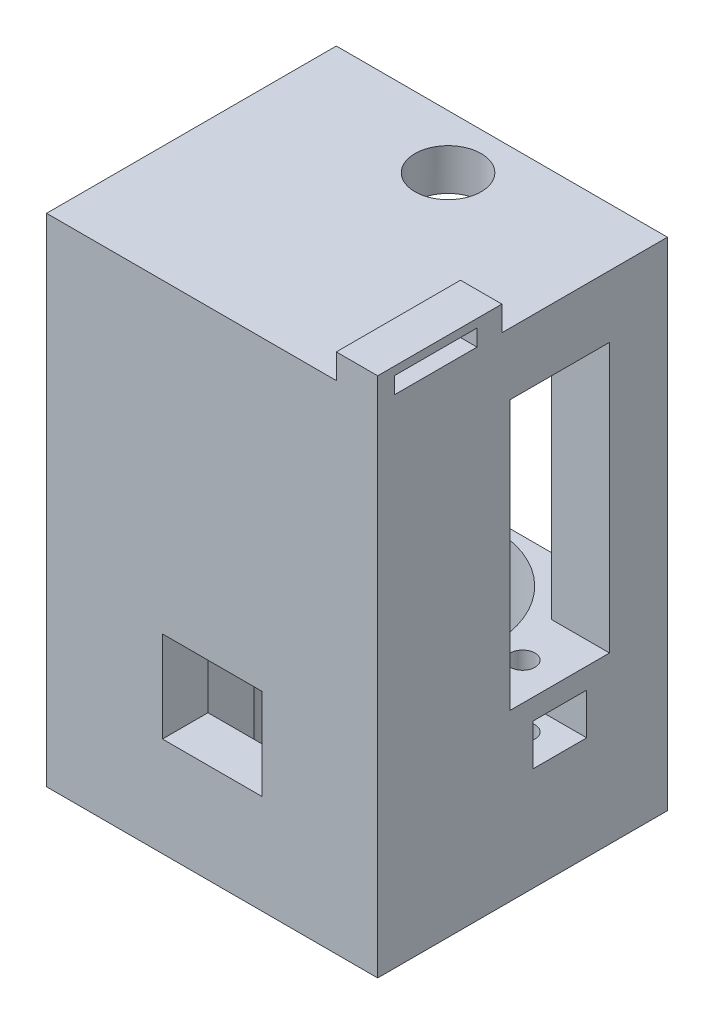
from build123d import *

# Parameters (mm, degrees)
ESBO_O2_W                                     = 40
ESBO_O2_H                                     = 35
BASE_DEPTH                                    = 20
FURO_DO_ENCAIXE_DO_MOTOR_DEPTH                = 57.789083458
ESBO_O5_R                                     = 1.5
FURO_DOS_PARAFUSOS_DO_MOTOR_DEPTH             = 57.789083458
ESBO_O6_W                                     = 6.5
ESBO_O6_H                                     = 5
FURO_DA_ARRUELA_PARA_PARAFUSOS_DO_MOTOR_DEPTH = 57.789083458
ESBO_O7_W                                     = 12
ESBO_O7_H                                     = 21.613382206
CALHA_PARA_OS_CABOS_DO_MOTOR_DEPTH            = 8
ESBO_O10_W                                    = 7
ESBO_O10_H                                    = 7
BASE_EXTENDIDA_DEPTH                          = 35
CHANFRO_DA_BASE_EXTENDIDA_REACH               = 75.068
PONTE_1_REACH                                 = 72.612
ESBO_O12_W                                    = 7
ESBO_O12_H                                    = 2.5
PONTE_2_REACH                                 = 72.612
ESBO_O13_W                                    = 7
ESBO_O13_H                                    = 2.5
ESBO_O14_W                                    = 40
ESBO_O14_H                                    = 35
TELHADO_DEPTH                                 = 5
ESBO_O16_W                                    = 5
ESBO_O16_H                                    = 15
RESSALTO_EXTRUS_O6_DEPTH                      = 3
ESBO_O17_W                                    = 10
ESBO_O17_H                                    = 2
CORTE_EXTRUS_O6_DEPTH                         = 8
ESBO_O18_R                                    = 4
FURO_DO_EIXO_DEPTH                            = 8
ESBO_O20_W                                    = 12
ESBO_O20_H                                    = 6
CORTE_EXTRUS_O8_DEPTH                         = 15


with BuildPart() as part:
    # Esboço2 → Base (new body)
    with BuildSketch(Plane(origin=(0, 0, 0), x_dir=(1, 0, 0), z_dir=(0, 1, 0))):
        with Locations((20, 17.5)):
            Rectangle(ESBO_O2_W, ESBO_O2_H)
    extrude(amount=BASE_DEPTH)

    # Esboço3 → Furo do encaixe do motor (cut, through all)
    with BuildSketch(Plane(origin=(0, 20, 0), x_dir=(1, 0, 0), z_dir=(0, 1, 0))):
        with BuildLine():
            Line((11.25, 13.787966147), (11.25, 5.5))
            Line((11.25, 5.5), (28.75, 5.5))
            Line((28.75, 5.5), (28.75, 13.787966147))
            ThreePointArc((28.75, 13.787966147), (20, 34), (11.25, 13.787966147))
        make_face()
    extrude(amount=-FURO_DO_ENCAIXE_DO_MOTOR_DEPTH, mode=Mode.SUBTRACT)

    # Esboço5 → Furo dos parafusos do motor (cut, through all)
    with BuildSketch(Plane(origin=(0, 20, 0), x_dir=(1, 0, 0), z_dir=(0, 1, 0))):
        with Locations((4.5, 22)):
            Circle(ESBO_O5_R)
        with Locations((35.5, 22)):
            Circle(ESBO_O5_R)
    extrude(amount=-FURO_DOS_PARAFUSOS_DO_MOTOR_DEPTH, mode=Mode.SUBTRACT)

    # Esboço6 → Furo da arruela para parafusos do motor (cut, through all)
    with BuildSketch(Plane(origin=(40, 0, 0), x_dir=(0, 0, -1), z_dir=(1, 0, 0))):
        with Locations((22, 15)):
            Rectangle(ESBO_O6_W, ESBO_O6_H)
    extrude(amount=-FURO_DA_ARRUELA_PARA_PARAFUSOS_DO_MOTOR_DEPTH, mode=Mode.SUBTRACT)

    # Esboço7 → Calha para os cabos do motor (cut)
    with BuildSketch(Plane(origin=(0, 20, 0), x_dir=(1, 0, 0), z_dir=(0, 1, 0))):
        with Locations((20, 7.545181244)):
            Rectangle(ESBO_O7_W, ESBO_O7_H)
    extrude(amount=-CALHA_PARA_OS_CABOS_DO_MOTOR_DEPTH, mode=Mode.SUBTRACT)

    # Esboço10 → Base extendida (add)
    with BuildSketch(Plane(origin=(0, 20, 0), x_dir=(1, 0, 0), z_dir=(0, 1, 0))):
        with Locations((3.5, 31.5)):
            Rectangle(ESBO_O10_W, ESBO_O10_H)
        with Locations((36.5, 31.5)):
            Rectangle(ESBO_O10_W, ESBO_O10_H)
        Polygon((7, 16), (0, 16), (0, 0), (40, 0), (40, 16), (33, 16), (33, 5.5), (7, 5.5), align=None)
    extrude(amount=BASE_EXTENDIDA_DEPTH)

    # Esboço11 → Chanfro da base extendida (add, up to next)
    with BuildSketch(Plane(origin=(7, 0, 0), x_dir=(0, 0, -1), z_dir=(1, 0, 0)), mode=Mode.PRIVATE) as chanfro_da_base_extendida_sk1:
        Polygon((16, 55), (16, 45), (5.5, 30.004445929), (5.5, 55), align=None)
    chanfro_da_base_extendida_tool1 = extrude(chanfro_da_base_extendida_sk1.sketch, amount=CHANFRO_DA_BASE_EXTENDIDA_REACH, mode=Mode.PRIVATE) - part.part
    add(chanfro_da_base_extendida_tool1.solids().sort_by_distance((7, 45.715647, -10.000127))[0])

    # Esboço12 → Ponte 1 (add, up to next)
    with BuildSketch(Plane(origin=(0, 0, -16), x_dir=(-1, 0, 0), z_dir=(0, 0, -1)), mode=Mode.PRIVATE) as ponte_1_sk1:
        with Locations((-36.5, 53.75)):
            Rectangle(ESBO_O12_W, ESBO_O12_H)
    ponte_1_tool1 = extrude(ponte_1_sk1.sketch, amount=PONTE_1_REACH, mode=Mode.PRIVATE) - part.part
    add(ponte_1_tool1.solids().sort_by_distance((36.5, 53.75, -16))[0])

    # Esboço13 → Ponte 2 (add, up to next)
    with BuildSketch(Plane(origin=(0, 0, -16), x_dir=(-1, 0, 0), z_dir=(0, 0, -1)), mode=Mode.PRIVATE) as ponte_2_sk1:
        with Locations((-3.5, 53.75)):
            Rectangle(ESBO_O13_W, ESBO_O13_H)
    ponte_2_tool1 = extrude(ponte_2_sk1.sketch, amount=PONTE_2_REACH, mode=Mode.PRIVATE) - part.part
    add(ponte_2_tool1.solids().sort_by_distance((3.5, 53.75, -16))[0])

    # Esboço14 → Telhado (add)
    with BuildSketch(Plane(origin=(0, 55, 0), x_dir=(1, 0, 0), z_dir=(0, 1, 0))):
        with Locations((20, 17.5)):
            Rectangle(ESBO_O14_W, ESBO_O14_H)
    extrude(amount=TELHADO_DEPTH)

    # Esboço16 → Ressalto-extrusão6 (add)
    with BuildSketch(Plane(origin=(0, 60, 0), x_dir=(1, 0, 0), z_dir=(0, 1, 0))):
        with Locations((37.5, 7.5)):
            Rectangle(ESBO_O16_W, ESBO_O16_H)
    extrude(amount=RESSALTO_EXTRUS_O6_DEPTH)

    # Esboço17 → Corte-extrusão6 (cut)
    with BuildSketch(Plane(origin=(40, 0, 0), x_dir=(0, 0, -1), z_dir=(1, 0, 0))):
        with Locations((7, 61)):
            Rectangle(ESBO_O17_W, ESBO_O17_H)
    extrude(amount=-CORTE_EXTRUS_O6_DEPTH, mode=Mode.SUBTRACT)

    # Esboço18 → Furo do Eixo (cut)
    with BuildSketch(Plane(origin=(0, 60, 0), x_dir=(1, 0, 0), z_dir=(0, 1, 0))):
        with Locations((20, 28.5)):
            Circle(ESBO_O18_R)
    extrude(amount=-FURO_DO_EIXO_DEPTH, mode=Mode.SUBTRACT)

    # Esboço20 → Corte-extrusão8 (cut)
    with BuildSketch(Plane(origin=(0, 0, -5.5), x_dir=(-1, 0, 0), z_dir=(0, 0, -1))):
        with Locations((-20, 20)):
            Rectangle(ESBO_O20_W, ESBO_O20_H)
    extrude(amount=-CORTE_EXTRUS_O8_DEPTH, mode=Mode.SUBTRACT)


solid = part.part
